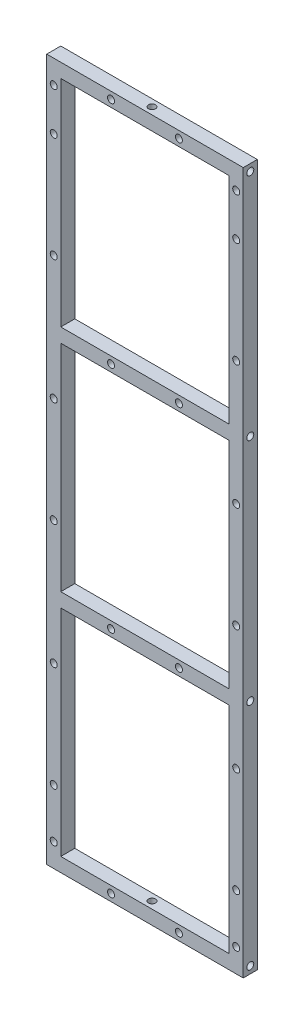
from build123d import *

# Parameters (mm, degrees)
SKETCH1_W           = 84
SKETCH1_H           = 300
SKETCH1_W_2         = 72
SKETCH1_H_2         = 92
BOSS_EXTRUDE1_DEPTH = 6
SKETCH2_R           = 1.5
CUT_EXTRUDE1_DEPTH  = 10
SKETCH3_R           = 1.5
CUT_EXTRUDE2_DEPTH  = 10
SKETCH4_R           = 1.5
CUT_EXTRUDE3_DEPTH  = 10
SKETCH5_R           = 1.5
CUT_EXTRUDE4_DEPTH  = 10


with BuildPart() as part:
    # Sketch1 → Boss-Extrude1 (new body)
    with BuildSketch(Plane.XY):
        Rectangle(SKETCH1_W, SKETCH1_H)
        with Locations((0, 98)):
            Rectangle(SKETCH1_W_2, SKETCH1_H_2, mode=Mode.SUBTRACT)
        with Locations((0, -98)):
            Rectangle(SKETCH1_W_2, SKETCH1_H_2, mode=Mode.SUBTRACT)
        Rectangle(SKETCH1_W_2, SKETCH1_H_2, mode=Mode.SUBTRACT)
    extrude(amount=BOSS_EXTRUDE1_DEPTH)

    # Sketch2 → Cut-Extrude1 (cut)
    with BuildSketch(Plane(origin=(42, 0, 0), x_dir=(0, 0, -1), z_dir=(1, 0, 0))):
        with Locations((-3, 147)):
            Circle(SKETCH2_R)
        with Locations((-3, 49)):
            Circle(SKETCH2_R)
        with Locations((-3, -49)):
            Circle(SKETCH2_R)
        with Locations((-3, -147)):
            Circle(SKETCH2_R)
    cut_extrude1 = extrude(amount=-CUT_EXTRUDE1_DEPTH, mode=Mode.SUBTRACT)

    # Mirror1: Cut-Extrude1 across plane
    add(cut_extrude1.mirror(Plane(origin=(0, 0, 0), x_dir=(0, 0, 1), z_dir=(1, 0, 0))), mode=Mode.SUBTRACT)

    # Sketch3 → Cut-Extrude2 (cut)
    with BuildSketch(Plane.XY.offset(6)):
        with Locations((-39, 140)):
            Circle(SKETCH3_R)
        with Locations((39, 140)):
            Circle(SKETCH3_R)
        with Locations((39, -140)):
            Circle(SKETCH3_R)
        with Locations((-39, -140)):
            Circle(SKETCH3_R)
    extrude(amount=-CUT_EXTRUDE2_DEPTH, mode=Mode.SUBTRACT)

    # Sketch4 → Cut-Extrude3 (cut)
    with BuildSketch(Plane.XY.offset(6)):
        with Locations((-14.5, 147)):
            Circle(SKETCH4_R)
        with Locations((14.5, 147)):
            Circle(SKETCH4_R)
        with Locations((14.5, 49)):
            Circle(SKETCH4_R)
        with Locations((-14.5, 49)):
            Circle(SKETCH4_R)
        with Locations((14.5, -49)):
            Circle(SKETCH4_R)
        with Locations((-14.5, -49)):
            Circle(SKETCH4_R)
        with Locations((14.5, -147)):
            Circle(SKETCH4_R)
        with Locations((-14.5, -147)):
            Circle(SKETCH4_R)
        with Locations((-39, 122)):
            Circle(SKETCH4_R)
        with Locations((-39, 77)):
            Circle(SKETCH4_R)
        with Locations((39, 122)):
            Circle(SKETCH4_R)
        with Locations((39, 77)):
            Circle(SKETCH4_R)
        with Locations((39, 24)):
            Circle(SKETCH4_R)
        with Locations((39, -21)):
            Circle(SKETCH4_R)
        with Locations((39, -74)):
            Circle(SKETCH4_R)
        with Locations((39, -119)):
            Circle(SKETCH4_R)
        with Locations((-39, 24)):
            Circle(SKETCH4_R)
        with Locations((-39, -21)):
            Circle(SKETCH4_R)
        with Locations((-39, -74)):
            Circle(SKETCH4_R)
        with Locations((-39, -119)):
            Circle(SKETCH4_R)
    extrude(amount=-CUT_EXTRUDE3_DEPTH, mode=Mode.SUBTRACT)

    # Sketch5 → Cut-Extrude4 (cut)
    with BuildSketch(Plane(origin=(0, 150, 0), x_dir=(1, 0, 0), z_dir=(0, 1, 0))):
        with Locations((0, -3)):
            Circle(SKETCH5_R)
    cut_extrude4 = extrude(amount=-CUT_EXTRUDE4_DEPTH, mode=Mode.SUBTRACT)

    # Mirror2: Cut-Extrude4 across plane
    add(cut_extrude4.mirror(Plane.ZX), mode=Mode.SUBTRACT)


solid = part.part
